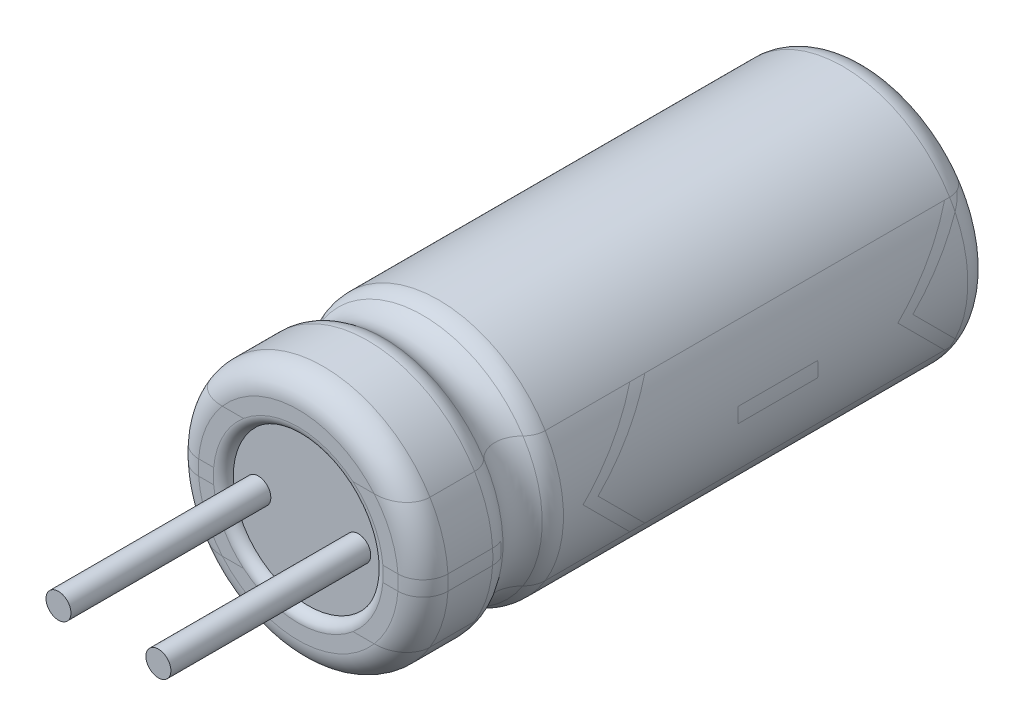
from build123d import *

# Parameters (mm, degrees)
SKETCH_2_R          = 1.5
CUT_EXTRUDE_1_DEPTH = 0.2
SKETCH_3_R          = 0.25
EXTRUDE_1_DEPTH     = 4
EXTRUDE_1_2_DEPTH   = 4
CUT_EXTRUDE_START   = -0.3
SKETCH_4_R          = 1.5
CUT_EXTRUDE_2_DEPTH = 0.3
FILLET_1_R          = 0.5
FILLET_2_R          = 0.2


with BuildPart() as part:
    # Эскиз1 → Повернуть1 (revolve)
    with BuildSketch(Plane(origin=(0, 0, 0), x_dir=(0, 0, -1), z_dir=(1, 0, 0)), mode=Mode.PRIVATE) as revolve_1_sk:
        with BuildLine():
            Line((-5.7, 0), (-5.7, 2.5))
            Line((-5.7, 2.5), (-4.307106781, 2.5))
            ThreePointArc((-4.307106781, 2.5), (-4.140440115, 2.471404521), (-3.992837101, 2.388888889))
            ThreePointArc((-3.992837101, 2.388888889), (-3.6, 2.25), (-3.207162899, 2.388888889))
            ThreePointArc((-3.207162899, 2.388888889), (-3.059559885, 2.471404521), (-2.892893219, 2.5))
            Line((-2.892893219, 2.5), (5.7, 2.5))
            Line((5.7, 2.5), (5.7, 0))
            Line((5.7, 0), (-5.7, 0))
        make_face()
    revolve(revolve_1_sk.sketch.rotate(Axis((0, 0, 10.81137326), (0, 0, -1)), 90), axis=Axis((0, 0, 10.81137326), (0, 0, -1)))

    # Эскиз2 → Вырез-Вытянуть1 (cut)
    with BuildSketch(Plane.XY.offset(5.7)):
        Circle(SKETCH_2_R)
    extrude(amount=-CUT_EXTRUDE_1_DEPTH, mode=Mode.SUBTRACT)

    # Эскиз4 → Вырез-Вытянуть2 (cut)
    with BuildSketch(Plane(origin=(0, 0, -5.7), x_dir=(-1, 0, 0), z_dir=(0, 0, -1)).offset(CUT_EXTRUDE_START)):
        with Locations(Location((0, 0, 0), (0, 0, 180))):
            Circle(SKETCH_4_R)
    extrude(amount=CUT_EXTRUDE_2_DEPTH, mode=Mode.SUBTRACT)

    # Скругление1
    fillet_1_edges = [part.edges().sort_by_distance(p)[0] for p in [
        (-2.5, 0, -5.7),
        (-2.5, 0, 5.7),
    ]]
    fillet(fillet_1_edges, radius=FILLET_1_R)

    # Скругление2
    fillet_2_edges = [part.edges().sort_by_distance(p)[0] for p in [
        (-1.5, 0, 5.7),
        (-1.5, 0, -5.7),
    ]]
    fillet(fillet_2_edges, radius=FILLET_2_R - 0.0001)  # a hair under: the kernel refuses the full size


with BuildPart() as body_2:
    # Эскиз3 → Бобышка-Вытянуть1 (new body)
    with BuildSketch(Plane.XY.offset(5.5)):
        with Locations((-1, 0)):
            Circle(SKETCH_3_R)
    extrude(amount=EXTRUDE_1_DEPTH)


with BuildPart() as body_3:
    # Эскиз3 → Extrude 1 2 (new body)
    with BuildSketch(Plane.XY.offset(5.5)):
        with Locations(Location((1, 0, 0), (0, 0, 180))):
            Circle(SKETCH_3_R)
    extrude(amount=EXTRUDE_1_2_DEPTH)


solid = Compound([part.part, body_2.part, body_3.part])
